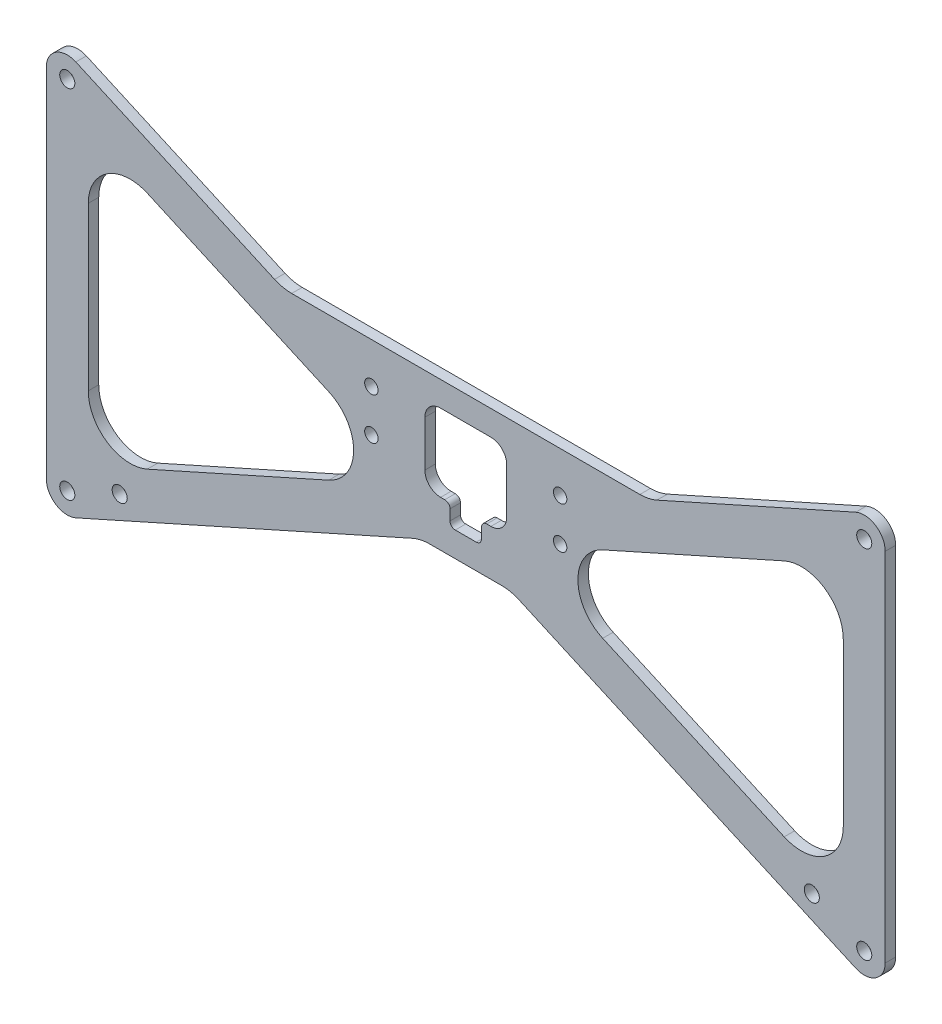
from build123d import *

# Parameters (mm, degrees)
BOSS_EXTRUDE1_DEPTH = 3.175
SKETCH2_R           = 2.286
CUT_EXTRUDE1_DEPTH  = 141.634939649
FILLET1_R           = 12.7
CUT_EXTRUDE2_DEPTH  = 141.634939649
FILLET2_R           = 1.5875
FILLET3_R           = 4.7625
SKETCH4_R           = 2.032
CUT_EXTRUDE3_DEPTH  = 141.634939649


with BuildPart() as part:
    # Sketch1 → Boss-Extrude1 (new body)
    with BuildSketch(Plane.XY):
        with BuildLine():
            Line((-118.056875519, -59.7713959), (-13.632338155, -13.0551555))
            Line((-13.632338155, -13.0551555), (13.632338155, -13.0551555))
            Line((13.632338155, -13.0551555), (118.056875519, -59.7713959))
            ThreePointArc((118.056875519, -59.7713959), (124.103705224, -59.303641499), (127, -53.975))
            Line((127, -53.975), (127, 53.975))
            ThreePointArc((127, 53.975), (124.103705224, 59.303641499), (118.056875519, 59.7713959))
            Line((118.056875519, 59.7713959), (55.420814096, 31.75))
            Line((55.420814096, 31.75), (-55.420814096, 31.75))
            Line((-55.420814096, 31.75), (-118.056875519, 59.7713959))
            ThreePointArc((-118.056875519, 59.7713959), (-124.103705224, 59.303641499), (-127, 53.975))
            Line((-127, 53.975), (-127, -53.975))
            ThreePointArc((-127, -53.975), (-124.103705224, -59.303641499), (-118.056875519, -59.7713959))
        make_face()
        Polygon((-114.3, -44.177732622), (-15.549774139, 0), (-114.3, 44.177732622), align=None, mode=Mode.SUBTRACT)
        Polygon((15.549774139, 0), (114.3, 44.177732622), (114.3, -44.177732622), align=None, mode=Mode.SUBTRACT)
    extrude(amount=BOSS_EXTRUDE1_DEPTH)

    # Sketch2 → Cut-Extrude1 (cut, through all)
    with BuildSketch(Plane.XY.offset(3.175)):
        with Locations((-120.65, 53.975)):
            Circle(SKETCH2_R)
        with Locations((-120.65, -53.975)):
            Circle(SKETCH2_R)
        with Locations((120.65, -53.975)):
            Circle(SKETCH2_R)
        with Locations((120.65, 53.975)):
            Circle(SKETCH2_R)
        with Locations((104.775, -46.873026316)):
            Circle(SKETCH2_R)
        with Locations((-104.775, -46.873026316)):
            Circle(SKETCH2_R)
    extrude(amount=-CUT_EXTRUDE1_DEPTH, mode=Mode.SUBTRACT)

    # Fillet1
    fillet1_edges = [part.edges().sort_by_distance(p)[0] for p in [
        (114.3, -44.177732622, 1.5875),
        (114.3, 44.177732622, 1.5875),
        (15.549774139, 0, 1.5875),
        (-114.3, -44.177732622, 1.5875),
        (-15.549774139, 0, 1.5875),
        (-114.3, 44.177732622, 1.5875),
        (-55.420814096, 31.75, 1.5875),
        (55.420814096, 31.75, 1.5875),
        (13.632338155, -13.0551555, 1.5875),
        (-13.632338155, -13.0551555, 1.5875),
    ]]
    fillet(fillet1_edges, radius=FILLET1_R)

    # Sketch3 → Cut-Extrude2 (cut, through all)
    with BuildSketch(Plane.XY.offset(3.175)):
        Polygon((-12.3825, 24.209375), (12.3825, 24.209375), (12.3825, 0.8334375), (4.7625, 0.8334375), (4.7625, -5.5165625), (-4.7625, -5.5165625), (-4.7625, 0.8334375), (-12.3825, 0.8334375), align=None)
    extrude(amount=-CUT_EXTRUDE2_DEPTH, mode=Mode.SUBTRACT)

    # Fillet2
    fillet2_edges = [part.edges().sort_by_distance(p)[0] for p in [
        (4.7625, -5.5165625, 1.5875),
        (-4.7625, -5.5165625, 1.5875),
        (4.7625, 0.8334375, 1.5875),
        (-4.7625, 0.8334375, 1.5875),
    ]]
    fillet(fillet2_edges, radius=FILLET2_R)

    # Fillet3
    fillet3_edges = [part.edges().sort_by_distance(p)[0] for p in [
        (12.3825, 0.8334375, 1.5875),
        (12.3825, 24.209375, 1.5875),
        (-12.3825, 0.8334375, 1.5875),
        (-12.3825, 24.209375, 1.5875),
    ]]
    fillet(fillet3_edges, radius=FILLET3_R)

    # Sketch4 → Cut-Extrude3 (cut, through all)
    with BuildSketch(Plane(origin=(0, 0, 0), x_dir=(-1, 0, 0), z_dir=(0, 0, -1))):
        with Locations((28.575, 19.406990631)):
            Circle(SKETCH4_R)
        with Locations((28.575, 6.706990631)):
            Circle(SKETCH4_R)
        with Locations((-28.575, 6.706990631)):
            Circle(SKETCH4_R)
        with Locations((-28.575, 19.406990631)):
            Circle(SKETCH4_R)
    extrude(amount=-CUT_EXTRUDE3_DEPTH, mode=Mode.SUBTRACT)


solid = part.part
